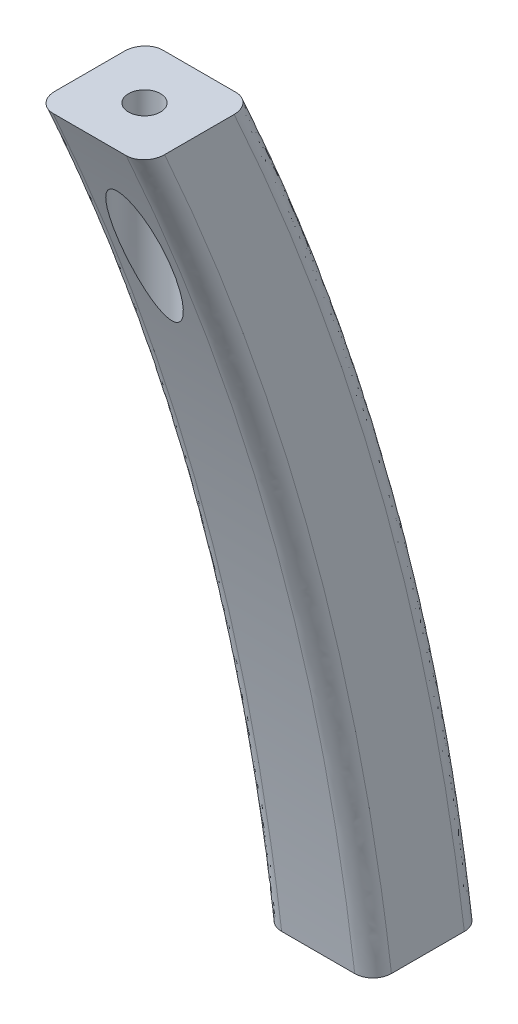
from build123d import *

# Parameters (mm, degrees)
SWEEP1_START               = -6
SWEEP1_DEPTH               = 12
SKETCH3_R                  = 3
CUT_EXTRUDE1_DEPTH         = 93.552687831
F_3_5_3_5_DIAMETER_HOLE1_D = 3.5
FILLET2_R                  = 2


# Read off the part's stored shape, not the designer's step: Sweep1
with BuildPart() as part:
    # Sweep1 outline → Sweep1 (new body)
    with BuildSketch(Plane.YZ.offset(SWEEP1_START)):
        with BuildLine():
            add(Edge.make_bspline(
                [(0, 6), (31.090204345, 9.606991211), (61.090204345, 17.940324544), (90, 31)],
                knots=[0, 0, 0, 0, 1, 1, 1, 1], degree=3))
            Line((0, 6), (0, -6))
            add(Edge.make_bspline(
                [(0, -6), (31.090204345, -2.393008789), (61.090204345, 5.940324544), (90, 19)],
                knots=[0, 0, 0, 0, 1, 1, 1, 1], degree=3))
            Line((90, 19), (90, 31))
        make_face()
    extrude(amount=SWEEP1_DEPTH)

    # Sketch3 → Cut-Extrude1 (cut, through all)
    with BuildSketch(Plane(origin=(0, 87, 0), x_dir=(1, 0, 0), z_dir=(0, 1, 0))):
        with Locations(Location((0, -25, 0), (0, 0, 270))):
            Circle(SKETCH3_R)
    extrude(amount=-CUT_EXTRUDE1_DEPTH, mode=Mode.SUBTRACT)

    # Ø3.5 (3.5) Diameter Hole1 (through all)
    with Locations(Plane(origin=(0, 87, 0), x_dir=(-1, 0, 0), z_dir=(0, -1, 0))):
        with Locations((0, -25)):
            Hole(F_3_5_3_5_DIAMETER_HOLE1_D / 2)

    # Fillet2
    fillet2_edges = [part.edges().sort_by_distance(p)[0] for p in [
        (6, 45.971752724, 14.998093053),
        (6, 45.971752724, 2.998093053),
        (-6, 45.971752724, 2.998093053),
        (-6, 45.971752724, 14.998093053),
    ]]
    fillet(fillet2_edges, radius=FILLET2_R)


solid = part.part
